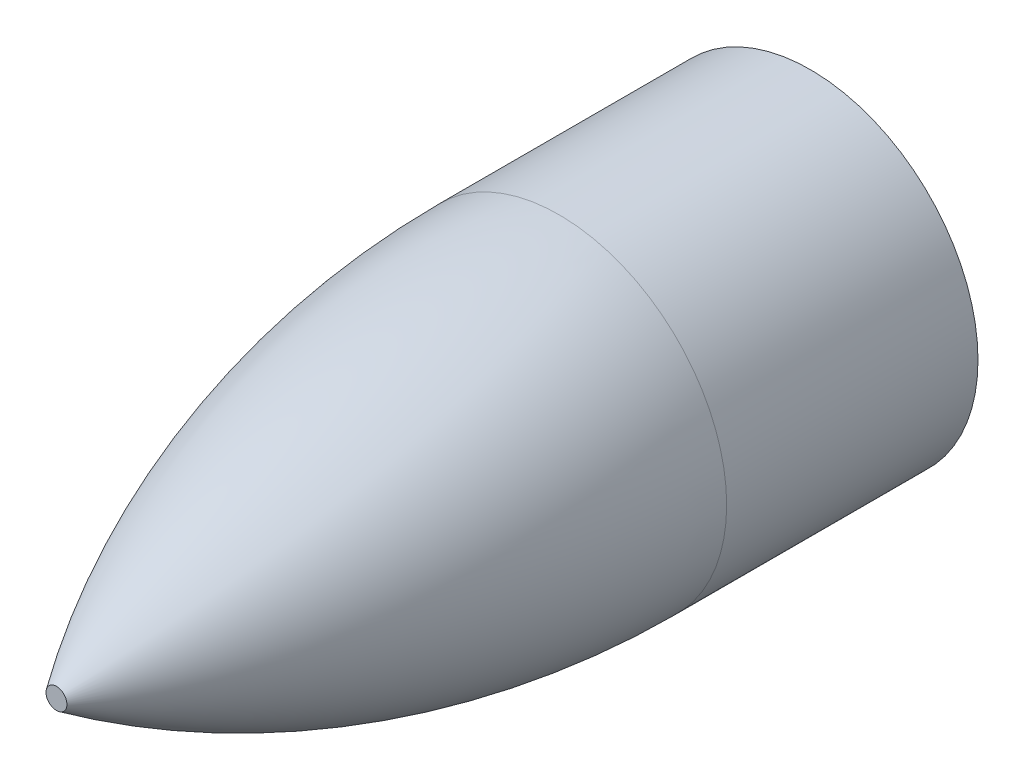
from build123d import *

# Parameters (mm, degrees)
SKETCH4_R           = 11.2395
CUT_EXTRUDE1_DEPTH  = 9.525
SKETCH5_W           = 2.921
SKETCH5_H           = 2.921
BOSS_EXTRUDE1_DEPTH = 1.8415


with BuildPart() as part:
    # Sketch3 → Revolve2 (revolve)
    with BuildSketch(Plane(origin=(0, 0, 0), x_dir=(0, 0, -1), z_dir=(1, 0, 0))):
        with BuildLine():
            Line((0, 0.79375), (0, 0))
            Line((0, 0), (35.2425, 0))
            ThreePointArc((35.2425, 0), (37.939314312, 6.510685688), (44.45, 9.2075))
            Line((44.45, 9.2075), (57.15, 9.2075))
            Line((57.15, 9.2075), (57.15, 12.7))
            Line((57.15, 12.7), (38.1, 12.7))
            ThreePointArc((38.1, 12.7), (18.1414881, 9.65411308), (0, 0.79375))
        make_face()
    revolve(axis=Axis((0, 0, 0), (0, 0, -1)))

    # Sketch4 → Cut-Extrude1 (cut)
    with BuildSketch(Plane(origin=(0, 0, -57.15), x_dir=(-1, 0, 0), z_dir=(0, 0, -1))):
        Circle(SKETCH4_R)
    extrude(amount=-CUT_EXTRUDE1_DEPTH, mode=Mode.SUBTRACT)

    # Sketch5 → Boss-Extrude1 (add)
    with BuildSketch(Plane(origin=(0, 11.43, 0), x_dir=(1, 0, 0), z_dir=(0, 1, 0))):
        with Locations((0, 55.6895)):
            Rectangle(SKETCH5_W, SKETCH5_H)
    boss_extrude1 = extrude(amount=-BOSS_EXTRUDE1_DEPTH)

    # Mirror1: Boss-Extrude1 across plane
    add(boss_extrude1.mirror(Plane.ZX))


solid = part.part
